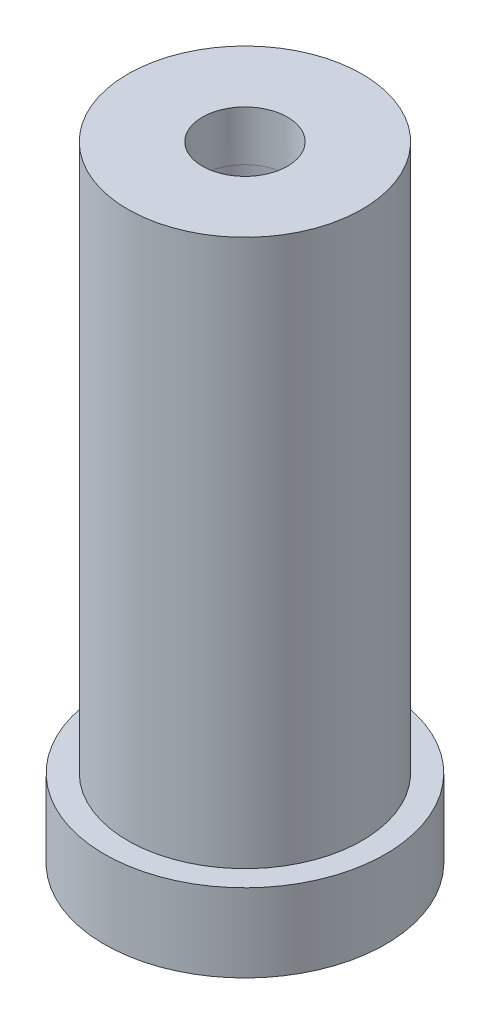
from build123d import *

# Parameters (mm, degrees)
CUT_EXTRUDE1_REACH = 43.976
SKETCH2_R          = 2.725


with BuildPart() as part:
    # Sketch1 → Revolve1 (revolve)
    with BuildSketch(Plane.XY):
        Polygon((0, 0), (9, 0), (9, 5), (7.5, 5), (7.5, 40), (0, 40), align=None)
    revolve(axis=Axis((0, 45, 0), (0, -1, 0)))

    # Sketch2 → Cut-Extrude1 (cut, up to next)
    with BuildSketch(Plane(origin=(0, 40, 0), x_dir=(1, 0, 0), z_dir=(0, 1, 0)), mode=Mode.PRIVATE) as cut_extrude1_sk1:
        Circle(SKETCH2_R)
    cut_extrude1_tool1 = extrude(cut_extrude1_sk1.sketch, amount=-CUT_EXTRUDE1_REACH, mode=Mode.PRIVATE) & part.part
    add(cut_extrude1_tool1.solids().sort_by_distance((0, 40, 0))[0], mode=Mode.SUBTRACT)

    # Cut-Sweep1: sweep along a curve in space
    with BuildLine() as cut_sweep1_path:
        ThreePointArc((0, 40, 2.725), (1.926865979, 40, 1.926865979), (2.725, 40, 0))
        ThreePointArc((2.725, 40, 0), (1.926865979, 40, -1.926865979), (0, 40, -2.725))
        ThreePointArc((0, 40, -2.725), (-1.926865979, 40, -1.926865979), (-2.725, 40, 0))
        ThreePointArc((-2.725, 40, 0), (-1.926865979, 40, 1.926865979), (0, 40, 2.725))
    # Sketch3 → Cut-Sweep1 (sweep, cut)
    with BuildSketch(Plane.XY):
        Polygon((2.725, 36.8), (3.688641914, 0), (2.725, 0), align=None)
    sweep(path=cut_sweep1_path.line, mode=Mode.SUBTRACT)


solid = part.part
